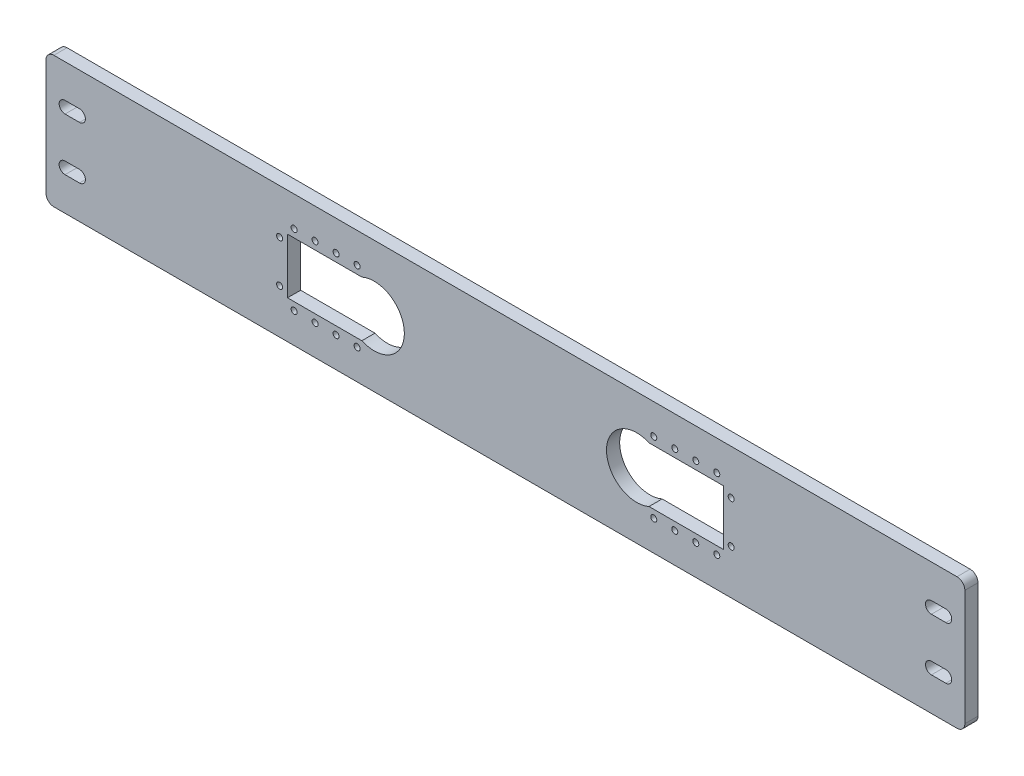
from build123d import *

# Parameters (mm, degrees)
SKETCH1_W           = 350
SKETCH1_H           = 50
BASE_FLANGE1_DEPTH  = 5
CUT_EXTRUDE1_REACH  = 178.847
SKETCH3_R           = 1.15
BREAK_CORNER2_START = -5
BREAK_CORNER2_DEPTH = 5


# Read off the part's stored shape, not the designer's step: Break-Corner2
# Sheet-metal steps are written as plain solids
with BuildPart() as part:
    # Sketch1 → Base-Flange1 (new body)
    with BuildSketch(Plane.XY):
        Rectangle(SKETCH1_W, SKETCH1_H)
        with BuildLine():
            Line((-167.75, -7.75), (-162.25, -7.75))
            ThreePointArc((-162.25, -7.75), (-160, -10), (-162.25, -12.25))
            Line((-162.25, -12.25), (-167.75, -12.25))
            ThreePointArc((-167.75, -12.25), (-170, -10), (-167.75, -7.75))
        make_face(mode=Mode.SUBTRACT)
        with BuildLine():
            Line((-167.75, 12.25), (-162.25, 12.25))
            ThreePointArc((-162.25, 12.25), (-160, 10), (-162.25, 7.75))
            Line((-162.25, 7.75), (-167.75, 7.75))
            ThreePointArc((-167.75, 7.75), (-170, 10), (-167.75, 12.25))
        make_face(mode=Mode.SUBTRACT)
        with BuildLine():
            Line((162.25, 12.25), (167.75, 12.25))
            ThreePointArc((167.75, 12.25), (170, 10), (167.75, 7.75))
            Line((167.75, 7.75), (162.25, 7.75))
            ThreePointArc((162.25, 7.75), (160, 10), (162.25, 12.25))
        make_face(mode=Mode.SUBTRACT)
        with BuildLine():
            Line((162.25, -7.75), (167.75, -7.75))
            ThreePointArc((167.75, -7.75), (170, -10), (167.75, -12.25))
            Line((167.75, -12.25), (162.25, -12.25))
            ThreePointArc((162.25, -12.25), (160, -10), (162.25, -7.75))
        make_face(mode=Mode.SUBTRACT)
    extrude(amount=-BASE_FLANGE1_DEPTH)

    # Sketch3 → Cut-Extrude1 (cut, up to next)
    with BuildSketch(Plane.XY, mode=Mode.PRIVATE) as cut_extrude1_sk1:
        with Locations((-80.5, 13.5)):
            Circle(SKETCH3_R)
    cut_extrude1_tool1 = extrude(cut_extrude1_sk1.sketch, amount=-CUT_EXTRUDE1_REACH, mode=Mode.PRIVATE) & part.part
    # Sketch3 → Cut-Extrude1 (cut, up to next)
    with BuildSketch(Plane.XY, mode=Mode.PRIVATE) as cut_extrude1_sk2:
        with Locations((-72.5, 13.5)):
            Circle(SKETCH3_R)
    cut_extrude1_tool2 = extrude(cut_extrude1_sk2.sketch, amount=-CUT_EXTRUDE1_REACH, mode=Mode.PRIVATE) & part.part
    # Sketch3 → Cut-Extrude1 (cut, up to next)
    with BuildSketch(Plane.XY, mode=Mode.PRIVATE) as cut_extrude1_sk3:
        with Locations((-64.5, 13.5)):
            Circle(SKETCH3_R)
    cut_extrude1_tool3 = extrude(cut_extrude1_sk3.sketch, amount=-CUT_EXTRUDE1_REACH, mode=Mode.PRIVATE) & part.part
    # Sketch3 → Cut-Extrude1 (cut, up to next)
    with BuildSketch(Plane.XY, mode=Mode.PRIVATE) as cut_extrude1_sk4:
        with Locations((-56.5, 13.5)):
            Circle(SKETCH3_R)
    cut_extrude1_tool4 = extrude(cut_extrude1_sk4.sketch, amount=-CUT_EXTRUDE1_REACH, mode=Mode.PRIVATE) & part.part
    # Sketch3 → Cut-Extrude1 (cut, up to next)
    with BuildSketch(Plane.XY, mode=Mode.PRIVATE) as cut_extrude1_sk5:
        with Locations((-86, -8)):
            Circle(SKETCH3_R)
    cut_extrude1_tool5 = extrude(cut_extrude1_sk5.sketch, amount=-CUT_EXTRUDE1_REACH, mode=Mode.PRIVATE) & part.part
    # Sketch3 → Cut-Extrude1 (cut, up to next)
    with BuildSketch(Plane.XY, mode=Mode.PRIVATE) as cut_extrude1_sk6:
        with Locations((-80.5, -13.5)):
            Circle(SKETCH3_R)
    cut_extrude1_tool6 = extrude(cut_extrude1_sk6.sketch, amount=-CUT_EXTRUDE1_REACH, mode=Mode.PRIVATE) & part.part
    # Sketch3 → Cut-Extrude1 (cut, up to next)
    with BuildSketch(Plane.XY, mode=Mode.PRIVATE) as cut_extrude1_sk7:
        with Locations((-72.5, -13.5)):
            Circle(SKETCH3_R)
    cut_extrude1_tool7 = extrude(cut_extrude1_sk7.sketch, amount=-CUT_EXTRUDE1_REACH, mode=Mode.PRIVATE) & part.part
    # Sketch3 → Cut-Extrude1 (cut, up to next)
    with BuildSketch(Plane.XY, mode=Mode.PRIVATE) as cut_extrude1_sk8:
        with Locations((-64.5, -13.5)):
            Circle(SKETCH3_R)
    cut_extrude1_tool8 = extrude(cut_extrude1_sk8.sketch, amount=-CUT_EXTRUDE1_REACH, mode=Mode.PRIVATE) & part.part
    # Sketch3 → Cut-Extrude1 (cut, up to next)
    with BuildSketch(Plane.XY, mode=Mode.PRIVATE) as cut_extrude1_sk9:
        with Locations((-56.5, -13.5)):
            Circle(SKETCH3_R)
    cut_extrude1_tool9 = extrude(cut_extrude1_sk9.sketch, amount=-CUT_EXTRUDE1_REACH, mode=Mode.PRIVATE) & part.part
    # Sketch3 → Cut-Extrude1 (cut, up to next)
    with BuildSketch(Plane.XY, mode=Mode.PRIVATE) as cut_extrude1_sk10:
        with Locations((-86, 8)):
            Circle(SKETCH3_R)
    cut_extrude1_tool10 = extrude(cut_extrude1_sk10.sketch, amount=-CUT_EXTRUDE1_REACH, mode=Mode.PRIVATE) & part.part
    # Sketch3 → Cut-Extrude1 (cut, up to next)
    with BuildSketch(Plane.XY, mode=Mode.PRIVATE) as cut_extrude1_sk11:
        with Locations((86, -8)):
            Circle(SKETCH3_R)
    cut_extrude1_tool11 = extrude(cut_extrude1_sk11.sketch, amount=-CUT_EXTRUDE1_REACH, mode=Mode.PRIVATE) & part.part
    # Sketch3 → Cut-Extrude1 (cut, up to next)
    with BuildSketch(Plane.XY, mode=Mode.PRIVATE) as cut_extrude1_sk12:
        with Locations((86, 8)):
            Circle(SKETCH3_R)
    cut_extrude1_tool12 = extrude(cut_extrude1_sk12.sketch, amount=-CUT_EXTRUDE1_REACH, mode=Mode.PRIVATE) & part.part
    # Sketch3 → Cut-Extrude1 (cut, up to next)
    with BuildSketch(Plane.XY, mode=Mode.PRIVATE) as cut_extrude1_sk13:
        with Locations((56.5, -13.5)):
            Circle(SKETCH3_R)
    cut_extrude1_tool13 = extrude(cut_extrude1_sk13.sketch, amount=-CUT_EXTRUDE1_REACH, mode=Mode.PRIVATE) & part.part
    # Sketch3 → Cut-Extrude1 (cut, up to next)
    with BuildSketch(Plane.XY, mode=Mode.PRIVATE) as cut_extrude1_sk14:
        with Locations((64.5, -13.5)):
            Circle(SKETCH3_R)
    cut_extrude1_tool14 = extrude(cut_extrude1_sk14.sketch, amount=-CUT_EXTRUDE1_REACH, mode=Mode.PRIVATE) & part.part
    # Sketch3 → Cut-Extrude1 (cut, up to next)
    with BuildSketch(Plane.XY, mode=Mode.PRIVATE) as cut_extrude1_sk15:
        with Locations((72.5, -13.5)):
            Circle(SKETCH3_R)
    cut_extrude1_tool15 = extrude(cut_extrude1_sk15.sketch, amount=-CUT_EXTRUDE1_REACH, mode=Mode.PRIVATE) & part.part
    # Sketch3 → Cut-Extrude1 (cut, up to next)
    with BuildSketch(Plane.XY, mode=Mode.PRIVATE) as cut_extrude1_sk16:
        with Locations((80.5, -13.5)):
            Circle(SKETCH3_R)
    cut_extrude1_tool16 = extrude(cut_extrude1_sk16.sketch, amount=-CUT_EXTRUDE1_REACH, mode=Mode.PRIVATE) & part.part
    # Sketch3 → Cut-Extrude1 (cut, up to next)
    with BuildSketch(Plane.XY, mode=Mode.PRIVATE) as cut_extrude1_sk17:
        with Locations((56.5, 13.5)):
            Circle(SKETCH3_R)
    cut_extrude1_tool17 = extrude(cut_extrude1_sk17.sketch, amount=-CUT_EXTRUDE1_REACH, mode=Mode.PRIVATE) & part.part
    # Sketch3 → Cut-Extrude1 (cut, up to next)
    with BuildSketch(Plane.XY, mode=Mode.PRIVATE) as cut_extrude1_sk18:
        with Locations((64.5, 13.5)):
            Circle(SKETCH3_R)
    cut_extrude1_tool18 = extrude(cut_extrude1_sk18.sketch, amount=-CUT_EXTRUDE1_REACH, mode=Mode.PRIVATE) & part.part
    # Sketch3 → Cut-Extrude1 (cut, up to next)
    with BuildSketch(Plane.XY, mode=Mode.PRIVATE) as cut_extrude1_sk19:
        with Locations((72.5, 13.5)):
            Circle(SKETCH3_R)
    cut_extrude1_tool19 = extrude(cut_extrude1_sk19.sketch, amount=-CUT_EXTRUDE1_REACH, mode=Mode.PRIVATE) & part.part
    # Sketch3 → Cut-Extrude1 (cut, up to next)
    with BuildSketch(Plane.XY, mode=Mode.PRIVATE) as cut_extrude1_sk20:
        with Locations((80.5, 13.5)):
            Circle(SKETCH3_R)
    cut_extrude1_tool20 = extrude(cut_extrude1_sk20.sketch, amount=-CUT_EXTRUDE1_REACH, mode=Mode.PRIVATE) & part.part
    # Sketch3 → Cut-Extrude1 (cut, up to next)
    with BuildSketch(Plane.XY, mode=Mode.PRIVATE) as cut_extrude1_sk21:
        with BuildLine():
            Line((-83, 10.5), (-54.69041576, 10.5))
            ThreePointArc((-54.69041576, 10.5), (-38.5, 0), (-54.69041576, -10.5))
            Line((-54.69041576, -10.5), (-83, -10.5))
            Line((-83, -10.5), (-83, 10.5))
        make_face()
    cut_extrude1_tool21 = extrude(cut_extrude1_sk21.sketch, amount=-CUT_EXTRUDE1_REACH, mode=Mode.PRIVATE) & part.part
    # Sketch3 → Cut-Extrude1 (cut, up to next)
    with BuildSketch(Plane.XY, mode=Mode.PRIVATE) as cut_extrude1_sk22:
        with BuildLine():
            Line((83, -10.5), (54.69041576, -10.5))
            ThreePointArc((54.69041576, -10.5), (38.5, 0), (54.69041576, 10.5))
            Line((54.69041576, 10.5), (83, 10.5))
            Line((83, 10.5), (83, -10.5))
        make_face()
    cut_extrude1_tool22 = extrude(cut_extrude1_sk22.sketch, amount=-CUT_EXTRUDE1_REACH, mode=Mode.PRIVATE) & part.part
    add(cut_extrude1_tool1.solids().sort_by_distance((-80.5, 13.5, 0))[0], mode=Mode.SUBTRACT)
    add(cut_extrude1_tool2.solids().sort_by_distance((-72.5, 13.5, 0))[0], mode=Mode.SUBTRACT)
    add(cut_extrude1_tool3.solids().sort_by_distance((-64.5, 13.5, 0))[0], mode=Mode.SUBTRACT)
    add(cut_extrude1_tool4.solids().sort_by_distance((-56.5, 13.5, 0))[0], mode=Mode.SUBTRACT)
    add(cut_extrude1_tool5.solids().sort_by_distance((-86, -8, 0))[0], mode=Mode.SUBTRACT)
    add(cut_extrude1_tool6.solids().sort_by_distance((-80.5, -13.5, 0))[0], mode=Mode.SUBTRACT)
    add(cut_extrude1_tool7.solids().sort_by_distance((-72.5, -13.5, 0))[0], mode=Mode.SUBTRACT)
    add(cut_extrude1_tool8.solids().sort_by_distance((-64.5, -13.5, 0))[0], mode=Mode.SUBTRACT)
    add(cut_extrude1_tool9.solids().sort_by_distance((-56.5, -13.5, 0))[0], mode=Mode.SUBTRACT)
    add(cut_extrude1_tool10.solids().sort_by_distance((-86, 8, 0))[0], mode=Mode.SUBTRACT)
    add(cut_extrude1_tool11.solids().sort_by_distance((86, -8, 0))[0], mode=Mode.SUBTRACT)
    add(cut_extrude1_tool12.solids().sort_by_distance((86, 8, 0))[0], mode=Mode.SUBTRACT)
    add(cut_extrude1_tool13.solids().sort_by_distance((56.5, -13.5, 0))[0], mode=Mode.SUBTRACT)
    add(cut_extrude1_tool14.solids().sort_by_distance((64.5, -13.5, 0))[0], mode=Mode.SUBTRACT)
    add(cut_extrude1_tool15.solids().sort_by_distance((72.5, -13.5, 0))[0], mode=Mode.SUBTRACT)
    add(cut_extrude1_tool16.solids().sort_by_distance((80.5, -13.5, 0))[0], mode=Mode.SUBTRACT)
    add(cut_extrude1_tool17.solids().sort_by_distance((56.5, 13.5, 0))[0], mode=Mode.SUBTRACT)
    add(cut_extrude1_tool18.solids().sort_by_distance((64.5, 13.5, 0))[0], mode=Mode.SUBTRACT)
    add(cut_extrude1_tool19.solids().sort_by_distance((72.5, 13.5, 0))[0], mode=Mode.SUBTRACT)
    add(cut_extrude1_tool20.solids().sort_by_distance((80.5, 13.5, 0))[0], mode=Mode.SUBTRACT)
    add(cut_extrude1_tool21.solids().sort_by_distance((-61.500767, 0, 0))[0], mode=Mode.SUBTRACT)
    add(cut_extrude1_tool22.solids().sort_by_distance((61.500767, 0, 0))[0], mode=Mode.SUBTRACT)

    # Break-Corner2 outline → Break-Corner2 (cut)
    with BuildSketch(Plane.XY.offset(BREAK_CORNER2_START)):
        with BuildLine():
            ThreePointArc((175, -22), (174.121320344, -24.121320344), (172, -25))
            Line((172, -25), (175, -25))
            Line((175, -25), (175, -22))
        make_face()
        with BuildLine():
            Line((-175, -25), (-172, -25))
            ThreePointArc((-172, -25), (-174.121320344, -24.121320344), (-175, -22))
            Line((-175, -22), (-175, -25))
        make_face()
        with BuildLine():
            ThreePointArc((172, 25), (174.121320344, 24.121320344), (175, 22))
            Line((175, 22), (175, 25))
            Line((175, 25), (172, 25))
        make_face()
        with BuildLine():
            Line((-175, 25), (-175, 22))
            ThreePointArc((-175, 22), (-174.121320344, 24.121320344), (-172, 25))
            Line((-172, 25), (-175, 25))
        make_face()
    extrude(amount=BREAK_CORNER2_DEPTH, mode=Mode.SUBTRACT)


solid = part.part
